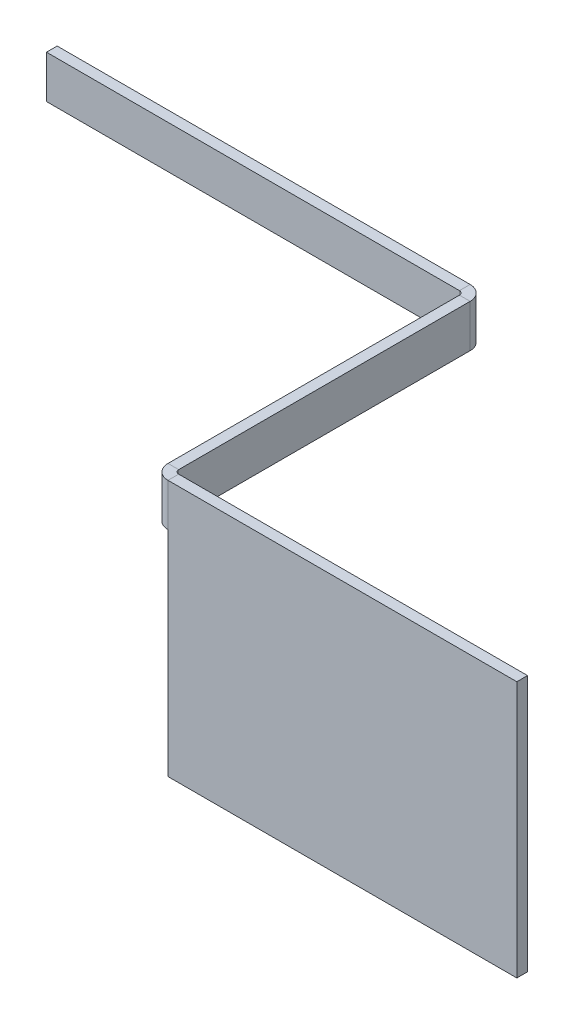
from build123d import *

# Parameters (mm, degrees)
CROQUIS1_W                       = 68
CROQUIS1_H                       = 48
BRIDA_BASE1_DEPTH                = 2
BRIDA_DE_ARISTA1_STRIP_W         = 9.4732
BRIDA_DE_ARISTA1_STRIP_H         = 2
BRIDA_DE_ARISTA1_STRIP_CUT_DEPTH = 48
BRIDA_DE_ARISTA1_DEPTH           = 48
BRIDA_DE_ARISTA2_STRIP_W         = 9.4732
BRIDA_DE_ARISTA2_STRIP_H         = 2
BRIDA_DE_ARISTA2_STRIP_CUT_DEPTH = 48
BRIDA_DE_ARISTA2_DEPTH           = 48
DESDOBLAR1_START                 = -121.8089982
DESDOBLAR1_DEPTH                 = 48
DESDOBLAR1_2_DEPTH               = 48
CROQUIS12_W                      = 137.245889802
CROQUIS12_H                      = 40
CORTAR_EXTRUIR1_DEPTH            = 2
DOBLAR1_START                    = -81.8089982
DOBLAR1_DEPTH                    = 8
DOBLAR1_2_DEPTH                  = 8


# Read off the part's stored shape, not the designer's step: Desdoblar1, Doblar1
# Sheet-metal steps are written as plain solids
with BuildPart() as part:
    # Croquis1 → Brida base1 (new body)
    with BuildSketch(Plane.XY.offset(452.5)):
        with Locations((-158.923759138, -97.8089982)):
            Rectangle(CROQUIS1_W, CROQUIS1_H)
    extrude(amount=-BRIDA_BASE1_DEPTH)

    # Brida de arista1 strip (across the edge) → Brida de arista1 strip cut (cut)
    with BuildSketch(Plane(origin=(-192.923759138, -121.8089982, 450.5), x_dir=(1, 0, 0), z_dir=(0, 1, 0))):
        with Locations((-2, -1)):
            Rectangle(BRIDA_DE_ARISTA1_STRIP_W, BRIDA_DE_ARISTA1_STRIP_H)
    extrude(amount=BRIDA_DE_ARISTA1_STRIP_CUT_DEPTH, mode=Mode.SUBTRACT)

    # Brida de arista1 section (across the edge) → Brida de arista1 (add)
    with BuildSketch(Plane(origin=(-192.923759138, -121.8089982, 450.5), x_dir=(1, 0, 0), z_dir=(0, 1, 0))):
        with BuildLine():
            Line((0, 0.7366), (0, 58))
            Line((0, 58), (2, 58))
            Line((2, 58), (2, 0.7366))
            ThreePointArc((2, 0.7366), (2.215745145, 0.215745145), (2.7366, 0))
            Line((2.7366, 0), (2.7366, -2))
            ThreePointArc((2.7366, -2), (0.801531583, -1.198468417), (0, 0.7366))
        make_face()
    extrude(amount=BRIDA_DE_ARISTA1_DEPTH)

    # Brida de arista2 strip (across the edge) → Brida de arista2 strip cut (cut)
    with BuildSketch(Plane(origin=(-192.923759138, -73.8089982, 392.5), x_dir=(0, 0, 1), z_dir=(0, -1, 0))):
        with Locations((-2, -1)):
            Rectangle(BRIDA_DE_ARISTA2_STRIP_W, BRIDA_DE_ARISTA2_STRIP_H)
    extrude(amount=BRIDA_DE_ARISTA2_STRIP_CUT_DEPTH, mode=Mode.SUBTRACT)

    # Brida de arista2 section (across the edge) → Brida de arista2 (add)
    with BuildSketch(Plane(origin=(-192.923759138, -73.8089982, 392.5), x_dir=(0, 0, 1), z_dir=(0, -1, 0))):
        with BuildLine():
            Line((0, 0.7366), (0, 78))
            Line((0, 78), (2, 78))
            Line((2, 78), (2, 0.7366))
            ThreePointArc((2, 0.7366), (2.215745145, 0.215745145), (2.7366, 0))
            Line((2.7366, 0), (2.7366, -2))
            ThreePointArc((2.7366, -2), (0.801531583, -1.198468417), (0, 0.7366))
        make_face()
    extrude(amount=BRIDA_DE_ARISTA2_DEPTH)

    # Desdoblar1 outline → Desdoblar1 (cut)
    with BuildSketch(Plane(origin=(0, 0, 0), x_dir=(1, 0, 0), z_dir=(0, 1, 0)).offset(DESDOBLAR1_START)):
        with BuildLine():
            ThreePointArc((-192.923759138, -449.7634), (-192.898392168, -450.135145906), (-192.822761536, -450.5))
            Line((-192.822761536, -450.5), (-190.187159138, -450.5))
            ThreePointArc((-190.187159138, -450.5), (-190.708013993, -450.284254855), (-190.923759138, -449.7634))
            Line((-190.923759138, -449.7634), (-190.923759138, -395.2366))
            ThreePointArc((-190.923759138, -395.2366), (-191.725290721, -393.301531583), (-193.660359138, -392.5))
            Line((-193.660359138, -392.5), (-270.923759138, -392.5))
            Line((-270.923759138, -392.5), (-270.923759138, -394.5))
            Line((-270.923759138, -394.5), (-193.660359138, -394.5))
            ThreePointArc((-193.660359138, -394.5), (-193.139504283, -394.715745145), (-192.923759138, -395.2366))
            Line((-192.923759138, -395.2366), (-192.923759138, -449.7634))
        make_face()
    extrude(amount=DESDOBLAR1_DEPTH, mode=Mode.SUBTRACT)

    # Desdoblar1 2 outline → Desdoblar1 2 (add)
    with BuildSketch(Plane(origin=(0, 0, 0), x_dir=(1, 0, 0), z_dir=(0, 1, 0)).offset(DESDOBLAR1_START)):
        with BuildLine():
            Line((-327.43304894, -452.5), (-190.187159138, -452.5))
            ThreePointArc((-190.187159138, -452.5), (-191.841426347, -451.943395312), (-192.822761536, -450.5))
            Line((-192.822761536, -450.5), (-327.43304894, -450.5))
            Line((-327.43304894, -450.5), (-327.43304894, -452.5))
        make_face()
    extrude(amount=DESDOBLAR1_2_DEPTH)

    # Croquis12 → Cortar-Extruir1 (cut)
    with BuildSketch(Plane.XY.offset(452.5)):
        with Locations((-258.810104039, -101.8089982)):
            Rectangle(CROQUIS12_W, CROQUIS12_H)
    extrude(amount=-CORTAR_EXTRUIR1_DEPTH, mode=Mode.SUBTRACT)

    # Doblar1 outline → Doblar1 (cut)
    with BuildSketch(Plane(origin=(0, 0, 0), x_dir=(1, 0, 0), z_dir=(0, 1, 0)).offset(DOBLAR1_START)):
        with BuildLine():
            ThreePointArc((-190.187159138, -452.5), (-191.841426347, -451.943395312), (-192.822761536, -450.5))
            Line((-192.822761536, -450.5), (-327.43304894, -450.5))
            Line((-327.43304894, -450.5), (-327.43304894, -452.5))
            Line((-327.43304894, -452.5), (-190.187159138, -452.5))
        make_face()
    extrude(amount=DOBLAR1_DEPTH, mode=Mode.SUBTRACT)

    # Doblar1 2 outline → Doblar1 2 (add)
    with BuildSketch(Plane(origin=(0, 0, 0), x_dir=(1, 0, 0), z_dir=(0, 1, 0)).offset(DOBLAR1_START)):
        with BuildLine():
            Line((-192.923759138, -395.2366), (-192.923759138, -449.7634))
            ThreePointArc((-192.923759138, -449.7634), (-192.898392168, -450.135145906), (-192.822761536, -450.5))
            Line((-192.822761536, -450.5), (-190.187159138, -450.5))
            ThreePointArc((-190.187159138, -450.5), (-190.708013993, -450.284254855), (-190.923759138, -449.7634))
            Line((-190.923759138, -449.7634), (-190.923759138, -395.2366))
            ThreePointArc((-190.923759138, -395.2366), (-191.725290721, -393.301531583), (-193.660359138, -392.5))
            Line((-193.660359138, -392.5), (-270.923759138, -392.5))
            Line((-270.923759138, -392.5), (-270.923759138, -394.5))
            Line((-270.923759138, -394.5), (-193.660359138, -394.5))
            ThreePointArc((-193.660359138, -394.5), (-193.139504283, -394.715745145), (-192.923759138, -395.2366))
        make_face()
    extrude(amount=DOBLAR1_2_DEPTH)


solid = part.part
